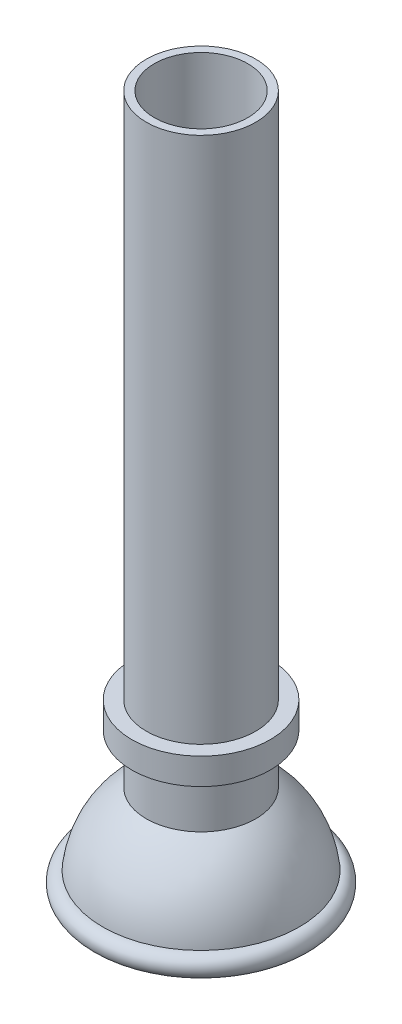
from build123d import *


with BuildPart() as part:
    # Sketch1 → Revolve1 (revolve)
    with BuildSketch(Plane.YZ):
        with BuildLine():
            Line((0, 9.017), (0, 10.541))
            Line((0, 10.541), (-101.6, 10.541))
            Line((-101.6, 10.541), (-101.6, 13.335))
            Line((-101.6, 13.335), (-106.68, 13.335))
            Line((-106.68, 13.335), (-106.68, 10.541))
            Line((-106.68, 10.541), (-116.212113594, 10.541))
            ThreePointArc((-116.212113594, 10.541), (-122.194746631, 16.284479293), (-130.050892014, 18.941626667))
            ThreePointArc((-130.050892014, 18.941626667), (-133.478000248, 20.524659048), (-132.08, 17.018))
            ThreePointArc((-132.08, 17.018), (-122.552460339, 14.101003936), (-116.291085408, 6.35))
            Line((-116.291085408, 6.35), (-106.68, 6.35))
            Line((-106.68, 6.35), (-106.68, 9.017))
            Line((-106.68, 9.017), (0, 9.017))
        make_face()
    revolve(axis=Axis((0, 0, 0), (0, -1, 0)))


solid = part.part
